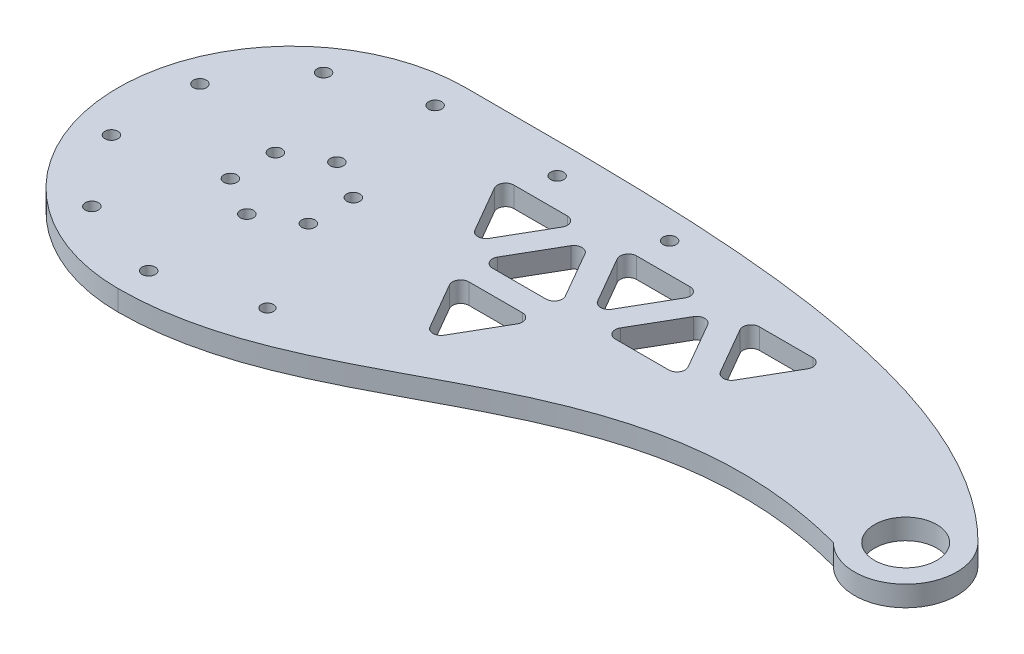
from build123d import *

# Parameters (mm, degrees)
BOSS_EXTRUDE3_OUTLINE_R = 7.6
BOSS_EXTRUDE3_DEPTH     = 5
SKETCH2_R               = 1.6
CUT_EXTRUDE1_DEPTH      = 10
SKETCH3_R               = 1.6
CUT_EXTRUDE2_DEPTH      = 10
SKETCH4_R               = 1.5
CUT_EXTRUDE3_DEPTH      = 10
SKETCH5_R               = 3.25
CUT_EXTRUDE4_DEPTH      = 1.5
CUT_EXTRUDE5_DEPTH      = 10
FILLET1_R               = 2
FILL_PATTERN1_DEPTH     = 5
CUT_EXTRUDE6_DEPTH      = 10
FILLET2_R               = 2
FILL_PATTERN2_DEPTH     = 5


# Read off the part's stored shape, not the designer's step: Boss-Extrude3, Fill Pattern1, Fill Pattern2
with BuildPart() as part:
    # Boss-Extrude3 outline → Boss-Extrude3 (new body)
    with BuildSketch(Plane(origin=(0, 0, 0), x_dir=(1, 0, 0), z_dir=(0, 1, 0))):
        with BuildLine():
            ThreePointArc((0, 42.5), (-42.5, 0), (0, -42.5))
            add(Edge.make_bspline(
                [(0, -42.5), (50, -42.5), (76.766110149, 8.415768242), (141.161165235, -8.838834765)],
                knots=[0, 0, 0, 0, 1, 1, 1, 1], degree=3))
            ThreePointArc((141.161165235, -8.838834765), (158.838834765, -8.838834765), (158.838834765, 8.838834765))
            add(Edge.make_bspline(
                [(0, 42.5), (53.483495706, 42.5), (123.483495706, 44.194173824), (158.838834765, 8.838834765)],
                knots=[0, 0, 0, 0, 1, 1, 1, 1], degree=3))
        make_face()
        with Locations((150, 0)):
            Circle(BOSS_EXTRUDE3_OUTLINE_R, mode=Mode.SUBTRACT)
    extrude(amount=BOSS_EXTRUDE3_DEPTH)

    # Sketch2 → Cut-Extrude1 (cut)
    with BuildSketch(Plane(origin=(0, 5, 0), x_dir=(1, 0, 0), z_dir=(0, 1, 0))):
        with Locations(Location((0, 35, 0), (0, 0, 270))):
            Circle(SKETCH2_R)
        with Locations(Location((0, 11, 0), (0, 0, 270))):
            Circle(SKETCH2_R)
        with Locations(Location((9.526279442, 5.5, 0), (0, 0, 270))):
            Circle(SKETCH2_R)
        with Locations(Location((9.526279442, -5.5, 0), (0, 0, 270))):
            Circle(SKETCH2_R)
        with Locations(Location((0, -11, 0), (0, 0, 270))):
            Circle(SKETCH2_R)
        with Locations(Location((-9.526279442, -5.5, 0), (0, 0, 270))):
            Circle(SKETCH2_R)
        with Locations(Location((-9.526279442, 5.5, 0), (0, 0, 270))):
            Circle(SKETCH2_R)
        with Locations(Location((-20.57248383, 28.315594803, 0), (0, 0, 270))):
            Circle(SKETCH2_R)
        with Locations(Location((-33.28697807, 10.815594803, 0), (0, 0, 270))):
            Circle(SKETCH2_R)
        with Locations(Location((-33.28697807, -10.815594803, 0), (0, 0, 270))):
            Circle(SKETCH2_R)
        with Locations(Location((-20.57248383, -28.315594803, 0), (0, 0, 270))):
            Circle(SKETCH2_R)
        with Locations(Location((0, -35, 0), (0, 0, 270))):
            Circle(SKETCH2_R)
    extrude(amount=-CUT_EXTRUDE1_DEPTH, mode=Mode.SUBTRACT)

    # Sketch3 → Cut-Extrude2 (cut)
    with BuildSketch(Plane(origin=(0, 5, 0), x_dir=(1, 0, 0), z_dir=(0, 1, 0))):
        with Locations(Location((29.822508304, 35, 0), (0, 0, 270))):
            Circle(SKETCH3_R)
        with Locations(Location((57.312909887, 35, 0), (0, 0, 270))):
            Circle(SKETCH3_R)
    extrude(amount=-CUT_EXTRUDE2_DEPTH, mode=Mode.SUBTRACT)

    # Sketch4 → Cut-Extrude3 (cut)
    with BuildSketch(Plane(origin=(0, 5, 0), x_dir=(1, 0, 0), z_dir=(0, 1, 0))):
        with Locations(Location((22.392043347, -28.36049342, 0), (0, 0, 270))):
            Circle(SKETCH4_R)
    extrude(amount=-CUT_EXTRUDE3_DEPTH, mode=Mode.SUBTRACT)

    # Sketch5 → Cut-Extrude4 (cut)
    with BuildSketch(Plane.XZ):
        with Locations(Location((0, 11, 0), (0, 0, 270))):
            Circle(SKETCH5_R)
        with Locations(Location((9.526279442, 5.5, 0), (0, 0, 270))):
            Circle(SKETCH5_R)
        with Locations(Location((9.526279442, -5.5, 0), (0, 0, 270))):
            Circle(SKETCH5_R)
        with Locations(Location((0, -11, 0), (0, 0, 270))):
            Circle(SKETCH5_R)
        with Locations(Location((-9.526279442, -5.5, 0), (0, 0, 270))):
            Circle(SKETCH5_R)
        with Locations(Location((-9.526279442, 5.5, 0), (0, 0, 270))):
            Circle(SKETCH5_R)
    extrude(amount=-CUT_EXTRUDE4_DEPTH, mode=Mode.SUBTRACT)

    # Sketch6 → Cut-Extrude5 (cut)
    with BuildSketch(Plane(origin=(0, 5, 0), x_dir=(1, 0, 0), z_dir=(0, 1, 0))):
        Polygon((43, 27.773502692), (23, 27.773502692), (33, 10.452994616), align=None)
    extrude(amount=-CUT_EXTRUDE5_DEPTH, mode=Mode.SUBTRACT)

    # Fillet1
    fillet1_edges = [part.edges().sort_by_distance(p)[0] for p in [
        (43, 2.5, -27.773502692),
        (33, 2.5, -10.452994616),
        (23, 2.5, -27.773502692),
    ]]
    fillet(fillet1_edges, radius=FILLET1_R)

    # Fill Pattern1 outline → Fill Pattern1 (cut)
    with BuildSketch(Plane(origin=(0, 0, 0), x_dir=(1, 0, 0), z_dir=(0, 1, 0))):
        with BuildLine():
            ThreePointArc((41.464101615, 1.792740578), (39.732050808, 0.792740578), (39.732050808, -1.207259422))
            Line((39.732050808, -1.207259422), (46.267949192, -12.527767497))
            ThreePointArc((46.267949192, -12.527767497), (48, -13.527767497), (49.732050808, -12.527767497))
            Line((49.732050808, -12.527767497), (56.267949192, -1.207259422))
            ThreePointArc((56.267949192, -1.207259422), (56.267949192, 0.792740578), (54.535898385, 1.792740578))
            Line((54.535898385, 1.792740578), (41.464101615, 1.792740578))
        make_face()
        with BuildLine():
            ThreePointArc((101.267949192, 24.773502692), (101.267949192, 26.773502692), (99.535898385, 27.773502692))
            Line((99.535898385, 27.773502692), (86.464101615, 27.773502692))
            ThreePointArc((86.464101615, 27.773502692), (84.732050808, 26.773502692), (84.732050808, 24.773502692))
            Line((84.732050808, 24.773502692), (91.267949192, 13.452994616))
            ThreePointArc((91.267949192, 13.452994616), (93, 12.452994616), (94.732050808, 13.452994616))
            Line((94.732050808, 13.452994616), (101.267949192, 24.773502692))
        make_face()
        with BuildLine():
            ThreePointArc((71.267949192, 24.773502692), (71.267949192, 26.773502692), (69.535898385, 27.773502692))
            Line((69.535898385, 27.773502692), (56.464101615, 27.773502692))
            ThreePointArc((56.464101615, 27.773502692), (54.732050808, 26.773502692), (54.732050808, 24.773502692))
            Line((54.732050808, 24.773502692), (61.267949192, 13.452994616))
            ThreePointArc((61.267949192, 13.452994616), (63, 12.452994616), (64.732050808, 13.452994616))
            Line((64.732050808, 13.452994616), (71.267949192, 24.773502692))
        make_face()
    extrude(amount=FILL_PATTERN1_DEPTH, mode=Mode.SUBTRACT)

    # Sketch8 → Cut-Extrude6 (cut)
    with BuildSketch(Plane(origin=(0, 5, 0), x_dir=(1, 0, 0), z_dir=(0, 1, 0))):
        Polygon((58, 7.56624327), (48, 24.886751346), (38, 7.56624327), align=None)
    extrude(amount=-CUT_EXTRUDE6_DEPTH, mode=Mode.SUBTRACT)

    # Fillet2
    fillet2_edges = [part.edges().sort_by_distance(p)[0] for p in [
        (58, 2.5, -7.56624327),
        (38, 2.5, -7.56624327),
        (48, 2.5, -24.886751346),
    ]]
    fillet(fillet2_edges, radius=FILLET2_R)

    # Fill Pattern2 outline → Fill Pattern2 (cut)
    with BuildSketch(Plane(origin=(0, 0, 0), x_dir=(1, 0, 0), z_dir=(0, 1, 0))):
        with BuildLine():
            ThreePointArc((69.732050808, 10.56624327), (69.732050808, 8.56624327), (71.464101615, 7.56624327))
            Line((71.464101615, 7.56624327), (84.535898385, 7.56624327))
            ThreePointArc((84.535898385, 7.56624327), (86.267949192, 8.56624327), (86.267949192, 10.56624327))
            Line((86.267949192, 10.56624327), (79.732050808, 21.886751346))
            ThreePointArc((79.732050808, 21.886751346), (78, 22.886751346), (76.267949192, 21.886751346))
            Line((76.267949192, 21.886751346), (69.732050808, 10.56624327))
        make_face()
    extrude(amount=FILL_PATTERN2_DEPTH, mode=Mode.SUBTRACT)


solid = part.part
